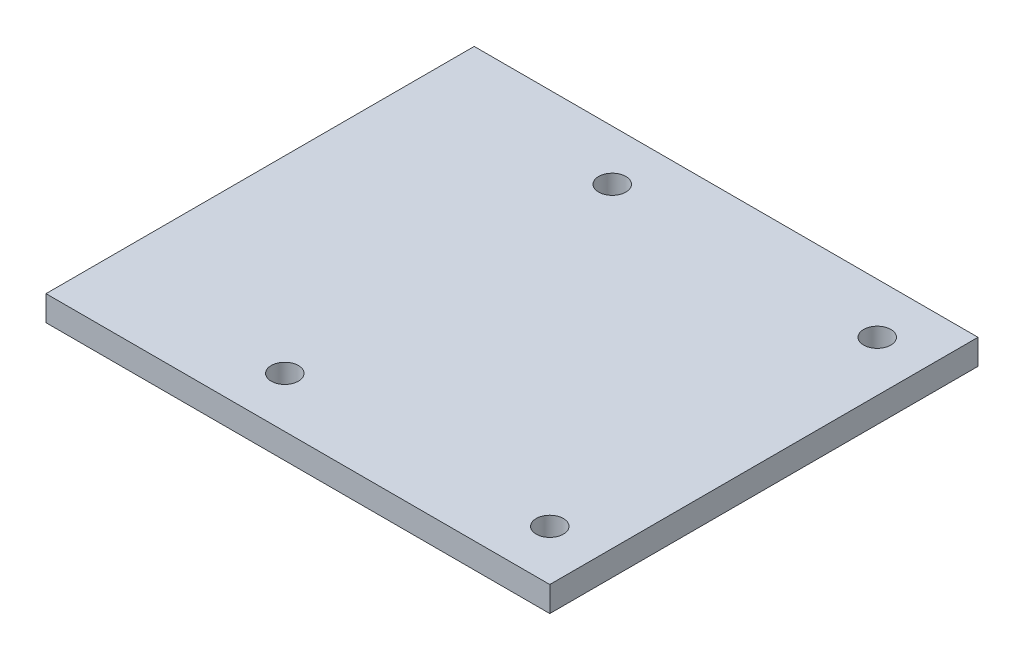
from build123d import *

# Parameters (mm, degrees)
SKETCH1_W           = 127
SKETCH1_H           = 107.95
BOSS_EXTRUDE1_DEPTH = 6.35
CUT_EXTRUDE2_REACH  = 85.582
SKETCH3_R           = 3.429


with BuildPart() as part:
    # Sketch1 → Boss-Extrude1 (new body)
    with BuildSketch(Plane(origin=(0, 0, 0), x_dir=(1, 0, 0), z_dir=(0, 1, 0))):
        Rectangle(SKETCH1_W, SKETCH1_H)
    extrude(amount=BOSS_EXTRUDE1_DEPTH)

    # Sketch3 → Cut-Extrude2 (cut, up to next)
    with BuildSketch(Plane.XZ, mode=Mode.PRIVATE) as cut_extrude2_sk1:
        with Locations((-16.002, 41.275)):
            Circle(SKETCH3_R)
    cut_extrude2_tool1 = extrude(cut_extrude2_sk1.sketch, amount=-CUT_EXTRUDE2_REACH, mode=Mode.PRIVATE) & part.part
    # Sketch3 → Cut-Extrude2 (cut, up to next)
    with BuildSketch(Plane.XZ, mode=Mode.PRIVATE) as cut_extrude2_sk2:
        with Locations((-16.002, -41.275)):
            Circle(SKETCH3_R)
    cut_extrude2_tool2 = extrude(cut_extrude2_sk2.sketch, amount=-CUT_EXTRUDE2_REACH, mode=Mode.PRIVATE) & part.part
    # Sketch3 → Cut-Extrude2 (cut, up to next)
    with BuildSketch(Plane.XZ, mode=Mode.PRIVATE) as cut_extrude2_sk3:
        with Locations((50.8, 41.275)):
            Circle(SKETCH3_R)
    cut_extrude2_tool3 = extrude(cut_extrude2_sk3.sketch, amount=-CUT_EXTRUDE2_REACH, mode=Mode.PRIVATE) & part.part
    # Sketch3 → Cut-Extrude2 (cut, up to next)
    with BuildSketch(Plane.XZ, mode=Mode.PRIVATE) as cut_extrude2_sk4:
        with Locations((50.8, -41.275)):
            Circle(SKETCH3_R)
    cut_extrude2_tool4 = extrude(cut_extrude2_sk4.sketch, amount=-CUT_EXTRUDE2_REACH, mode=Mode.PRIVATE) & part.part
    add(cut_extrude2_tool1.solids().sort_by_distance((-16.002, 0, 41.275))[0], mode=Mode.SUBTRACT)
    add(cut_extrude2_tool2.solids().sort_by_distance((-16.002, 0, -41.275))[0], mode=Mode.SUBTRACT)
    add(cut_extrude2_tool3.solids().sort_by_distance((50.8, 0, 41.275))[0], mode=Mode.SUBTRACT)
    add(cut_extrude2_tool4.solids().sort_by_distance((50.8, 0, -41.275))[0], mode=Mode.SUBTRACT)


solid = part.part
